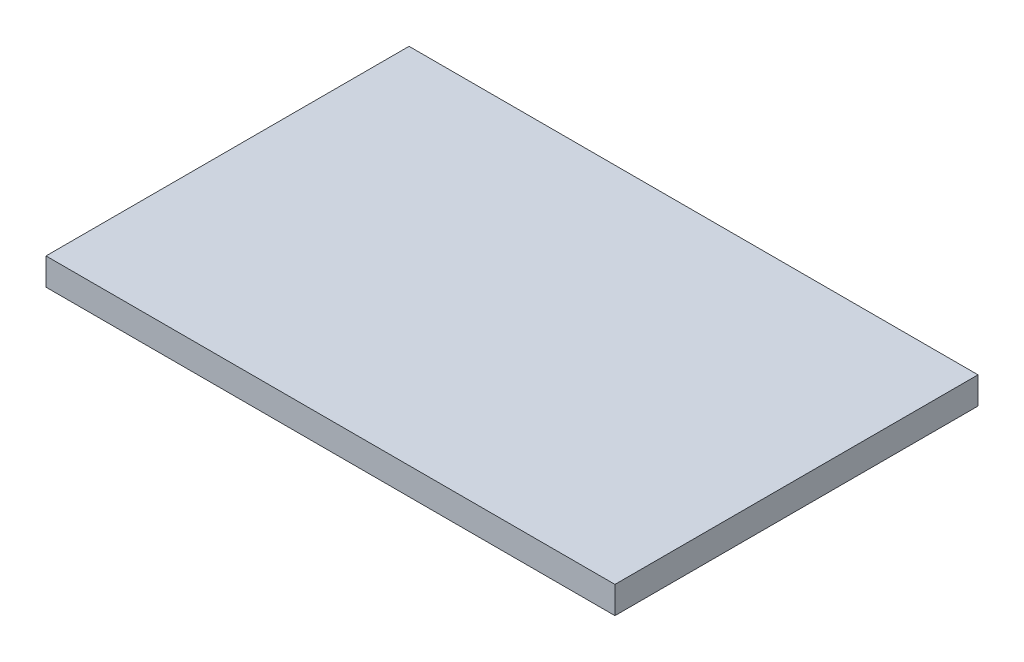
from build123d import *

# Parameters (mm, degrees)
SKETCH1_W           = 133.35
SKETCH1_H           = 85.09
BOSS_EXTRUDE1_DEPTH = 6.35


with BuildPart() as part:
    # Sketch1 → Boss-Extrude1 (new body)
    with BuildSketch(Plane(origin=(0, 0, 0), x_dir=(1, 0, 0), z_dir=(0, 1, 0))):
        with Locations((21.486627907, 5.109534884)):
            Rectangle(SKETCH1_W, SKETCH1_H)
    extrude(amount=BOSS_EXTRUDE1_DEPTH)


solid = part.part
